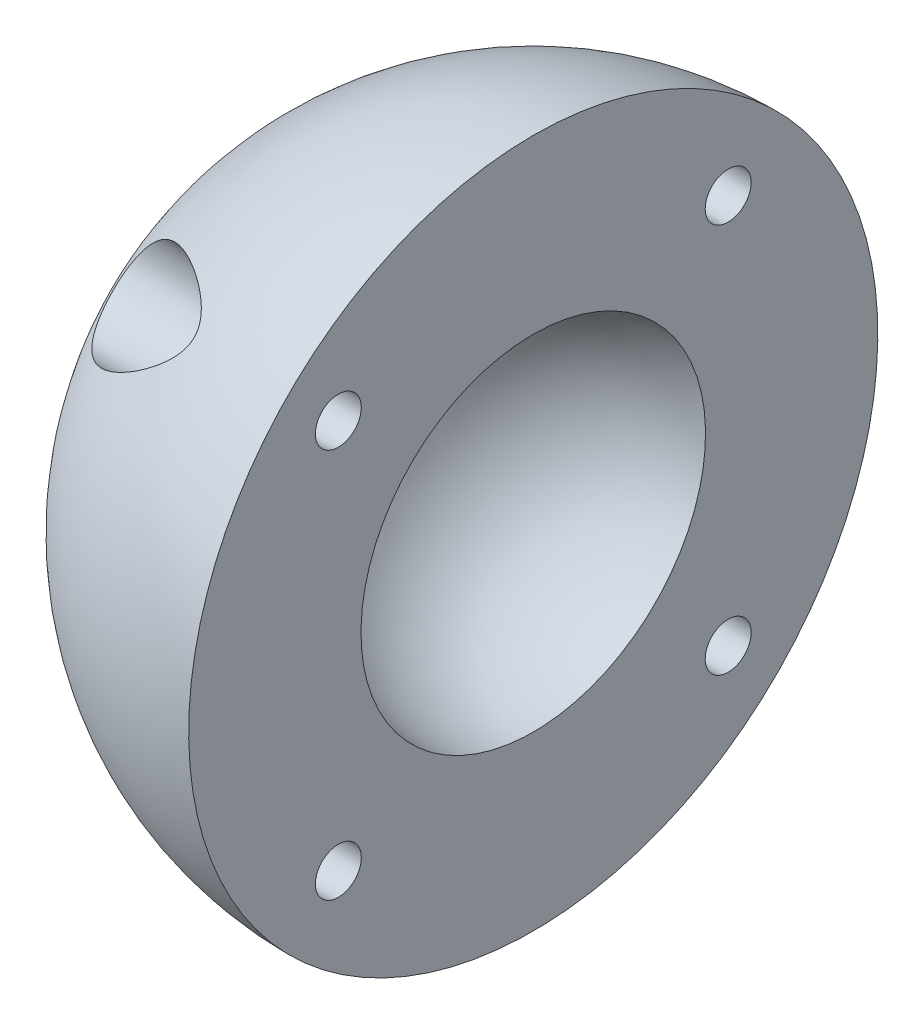
from build123d import *

# Parameters (mm, degrees)
CUT_EXTRUDE3_DEPTH      = 52.961524227
CUT_EXTRUDE3_DEPTH_BACK = 52.961524227
SKETCH4_R               = 2
SKETCH5_R               = 4.5
CUT_EXTRUDE4_DEPTH      = 51.289163843


with BuildPart() as part:
    # Sketch3 → Revolve1 (revolve)
    with BuildSketch(Plane.XY):
        with BuildLine():
            Line((-30, 0), (-15, 0))
            ThreePointArc((-15, 0), (-10.606601718, 10.606601718), (0, 15))
            Line((0, 15), (0, 30))
            ThreePointArc((0, 30), (-21.213203436, 21.213203436), (-30, 0))
        make_face()
    revolve(axis=Axis((0, 0, 0), (-1, 0, 0)))

    # Sketch4 → Cut-Extrude3 (cut, two sides: drawn at the far end of the back side and taken through both)
    with BuildSketch(Plane(origin=(0, 0, 0), x_dir=(0, 0, -1), z_dir=(1, 0, 0)).offset(-CUT_EXTRUDE3_DEPTH_BACK)):
        with Locations((-16.970562748, 16.970562748)):
            Circle(SKETCH4_R)
        with Locations((16.970562748, 16.970562748)):
            Circle(SKETCH4_R)
        with Locations((16.970562748, -16.970562748)):
            Circle(SKETCH4_R)
        with Locations((-16.970562748, -16.970562748)):
            Circle(SKETCH4_R)
    extrude(amount=CUT_EXTRUDE3_DEPTH + CUT_EXTRUDE3_DEPTH_BACK, mode=Mode.SUBTRACT)

    # Sketch5 → Cut-Extrude4 (cut, through all)
    with BuildSketch(Plane(origin=(-3, 0, 0), x_dir=(0, 0, -1), z_dir=(1, 0, 0))):
        with Locations((-16.970562748, 16.970562748)):
            Circle(SKETCH5_R)
        with Locations((16.970562748, 16.970562748)):
            Circle(SKETCH5_R)
        with Locations((16.970562748, -16.970562748)):
            Circle(SKETCH5_R)
        with Locations((-16.970562748, -16.970562748)):
            Circle(SKETCH5_R)
    extrude(amount=-CUT_EXTRUDE4_DEPTH, mode=Mode.SUBTRACT)


solid = part.part
